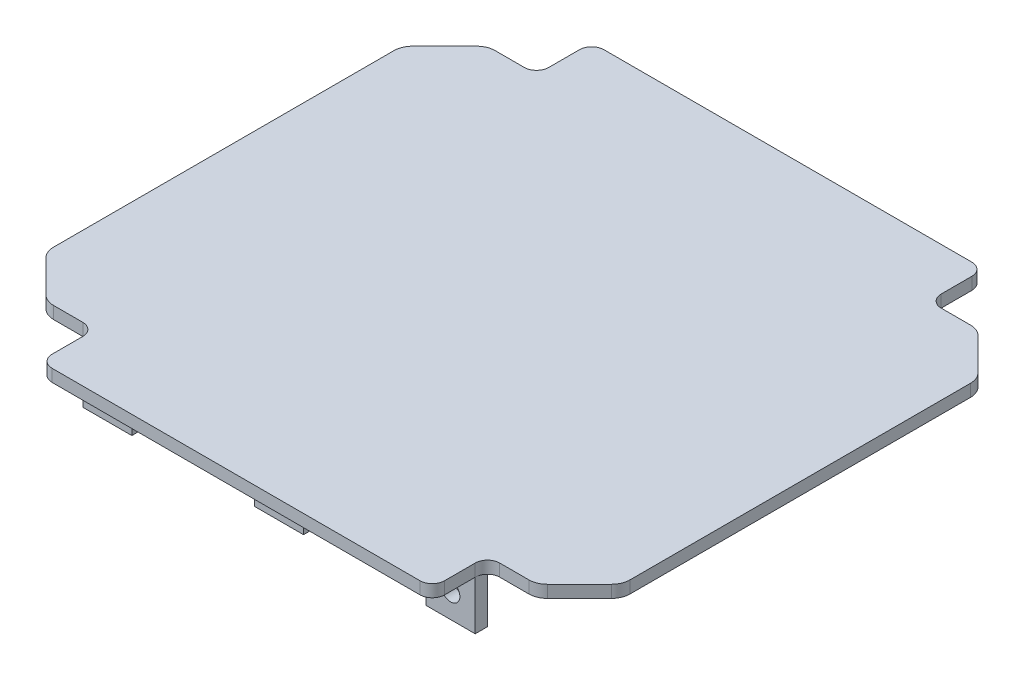
from build123d import *

# Parameters (mm, degrees)
SKETCH_1_W              = 94
SKETCH_1_H              = 72
EXTRUDE_1_DEPTH         = 2
SKETCH_2_W              = 8
SKETCH_2_H              = 10
EXTRUDE_2_DEPTH         = 2
FILLET_4_R              = 2
FILLET_5_R              = 2
SKETCH_3_R              = 1.5
CUT_EXTRUDE_1_DEPTH     = 90.716219269
SKETCH_4_W              = 64
SKETCH_4_H              = 2
EXTRUDE_3_DEPTH         = 45
FILLET_6_R              = 2
CONG_2_R                = 2
ENL_V_MAT_EXTRU_1_DEPTH = 66.833122363
CONG_3_R                = 3


with BuildPart() as part:
    # Эскиз1 → Бобышка-Вытянуть1 (new body)
    with BuildSketch(Plane(origin=(0, 0, 0), x_dir=(1, 0, 0), z_dir=(0, 1, 0))):
        Rectangle(SKETCH_1_W, SKETCH_1_H)
    extrude(amount=EXTRUDE_1_DEPTH)

    # Эскиз2 → Бобышка-Вытянуть2 (add)
    with BuildSketch(Plane.XY.offset(36)):
        with Locations((-28, -3)):
            Rectangle(SKETCH_2_W, SKETCH_2_H)
        with Locations((28, -3)):
            Rectangle(SKETCH_2_W, SKETCH_2_H)
        with Locations((0, -3)):
            Rectangle(SKETCH_2_W, SKETCH_2_H)
    extrude_2 = extrude(amount=EXTRUDE_2_DEPTH)

    # Скругление4
    fillet_4_edges = [part.edges().sort_by_distance(p)[0] for p in [
        (-24, 1, 36),
        (32, 1, 36),
        (4, 1, 36),
        (24, 1, 36),
        (-4, 1, 36),
        (-32, 1, 36),
    ]]
    fillet(fillet_4_edges, radius=FILLET_4_R - 0.0001)  # a hair under: the kernel refuses the full size

    # Зеркальное отражение1: Бобышка-Вытянуть2 across plane
    add(extrude_2.mirror(Plane.XY))

    # Скругление5
    fillet_5_edges = [part.edges().sort_by_distance(p)[0] for p in [
        (24, 1, -36),
        (-4, 1, -36),
        (-32, 1, -36),
        (-24, 1, -36),
        (4, 1, -36),
        (32, 1, -36),
    ]]
    fillet(fillet_5_edges, radius=FILLET_5_R - 0.0001)  # a hair under: the kernel refuses the full size

    # Эскиз3 → Вырез-Вытянуть1 (cut, through all)
    with BuildSketch(Plane(origin=(0, 0, -38), x_dir=(-1, 0, 0), z_dir=(0, 0, -1))):
        with Locations((-28, -4)):
            Circle(SKETCH_3_R)
        with Locations((0, -4)):
            Circle(SKETCH_3_R)
        with Locations((28, -4)):
            Circle(SKETCH_3_R)
    extrude(amount=-CUT_EXTRUDE_1_DEPTH, mode=Mode.SUBTRACT)

    # Эскиз4 → Бобышка-Вытянуть3 (add, symmetric)
    with BuildSketch(Plane(origin=(0, 0, 0), x_dir=(-1, 0, 0), z_dir=(0, 0, -1))):
        with Locations((0, 1)):
            Rectangle(SKETCH_4_W, SKETCH_4_H)
    extrude(amount=EXTRUDE_3_DEPTH, both=True)

    # Скругление6
    fillet_6_edges = [part.edges().sort_by_distance(p)[0] for p in [
        (-32, 1, 45),
        (32, 1, 45),
        (-32, 1, -45),
        (32, 1, -45),
    ]]
    fillet(fillet_6_edges, radius=FILLET_6_R)

    # Congé2
    cong_2_edges = [part.edges().sort_by_distance(p)[0] for p in [
        (47, 1, 36),
        (-47, 1, 36),
        (-47, 1, -36),
        (47, 1, -36),
    ]]
    fillet(cong_2_edges, radius=CONG_2_R)

    # Esquisse1 → Enlèv. mat.-Extru.1 (cut, through all)
    with BuildSketch(Plane(origin=(0, 2, 0), x_dir=(1, 0, 0), z_dir=(0, 1, 0))):
        Polygon((-47, -29), (-40, -36), (-47, -36), align=None)
        Polygon((-47, 36), (-40, 36), (-47, 29), align=None)
        Polygon((47, -29), (47, -36), (40, -36), align=None)
        Polygon((47, 29), (47, 36), (40, 36), align=None)
    extrude(amount=-ENL_V_MAT_EXTRU_1_DEPTH, mode=Mode.SUBTRACT)

    # Congé3
    cong_3_edges = [part.edges().sort_by_distance(p)[0] for p in [
        (-47, 1, -29),
        (-40, 1, -36),
        (40, 1, 36),
        (47, 1, 29),
        (47, 1, -29),
        (40, 1, -36),
        (-47, 1, 29),
        (-40, 1, 36),
    ]]
    fillet(cong_3_edges, radius=CONG_3_R)


solid = part.part
